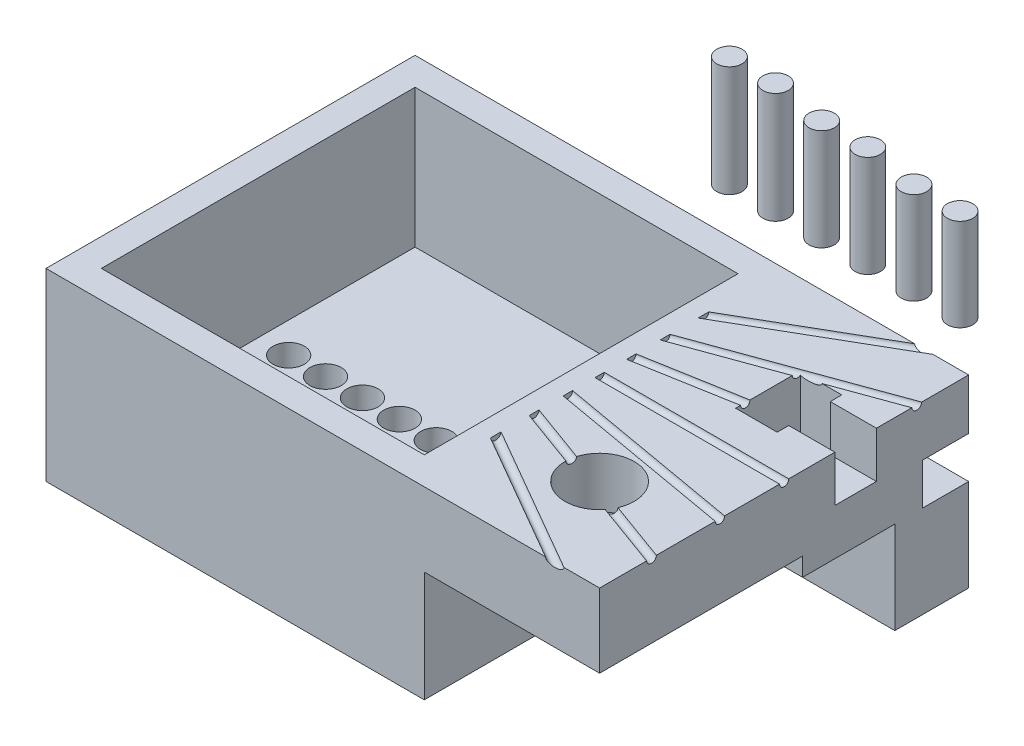
from build123d import *

# Parameters (mm, degrees)
SKETCH1_W               = 60
SKETCH1_H               = 40
BOSS_EXTRUDE1_DEPTH     = 20
SKETCH3_W               = 35
SKETCH3_H               = 34
CUT_EXTRUDE2_DEPTH      = 15
SKETCH4_R               = 3.75
CUT_EXTRUDE3_DEPTH      = 5.5
CUT_EXTRUDE4_DEPTH      = 39.861935104
CUT_EXTRUDE4_DEPTH_BACK = 39.861935104
SKETCH5_R               = 2.25
CUT_EXTRUDE5_DEPTH      = 42.231056256
CUT_EXTRUDE5_DEPTH_BACK = 5
SKETCH6_W               = 5
SKETCH6_H               = 4.5
SKETCH7_W               = 4.5
SKETCH7_H               = 7
CUT_EXTRUDE6_DEPTH      = 6.5
SKETCH8_W               = 5
SKETCH8_H               = 4.5
CUT_EXTRUDE7_DEPTH      = 5
SKETCH9_W               = 4.5
SKETCH9_H               = 7
CUT_EXTRUDE8_DEPTH      = 6.5
SKETCH13_R              = 1.7
CUT_EXTRUDE9_DEPTH      = 3
SKETCH14_R              = 1.375
BOSS_EXTRUDE2_DEPTH     = 14
BOSS_EXTRUDE2_2_DEPTH   = 14
BOSS_EXTRUDE2_3_DEPTH   = 14
BOSS_EXTRUDE2_4_DEPTH   = 14
BOSS_EXTRUDE2_5_DEPTH   = 14
BOSS_EXTRUDE2_6_DEPTH   = 14
SKETCH17_R              = 1.375
CUT_EXTRUDE10_DEPTH     = 2
SKETCH18_R              = 1.375
CUT_EXTRUDE11_DEPTH     = 3
SKETCH19_R              = 1.375
CUT_EXTRUDE12_DEPTH     = 4
CUT_SWEEP2_PROFILE_R    = 0.5
CUT_SWEEP3_START        = 8
CUT_SWEEP3_DEPTH        = 22
CUT_SWEEP3_START_2      = 8.326128564
CUT_SWEEP3_2_DEPTH      = 22.515712442
CUT_SWEEP4_PROFILE_R    = 0.5
CUT_SWEEP5_PROFILE_R    = 0.5
BOSS_EXTRUDE3_REACH     = 55.852
SKETCH43_W              = 2
SKETCH43_H              = 2
SKETCH64_W              = 19
SKETCH64_H              = 22
CUT_EXTRUDE13_DEPTH     = 12
SKETCH65_W              = 19
SKETCH65_H              = 10
CUT_EXTRUDE14_DEPTH     = 10


# Read off the part's stored shape, not the designer's step: Cut-Sweep3
with BuildPart() as part:
    # Sketch1 → Boss-Extrude1 (new body)
    with BuildSketch(Plane(origin=(0, 0, 0), x_dir=(1, 0, 0), z_dir=(0, 1, 0))):
        Rectangle(SKETCH1_W, SKETCH1_H)
    extrude(amount=BOSS_EXTRUDE1_DEPTH)

    # Sketch3 → Cut-Extrude2 (cut)
    with BuildSketch(Plane(origin=(0, 20, 0), x_dir=(1, 0, 0), z_dir=(0, 1, 0))):
        with Locations((-9.5, 0)):
            Rectangle(SKETCH3_W, SKETCH3_H)
    extrude(amount=-CUT_EXTRUDE2_DEPTH, mode=Mode.SUBTRACT)

    # Sketch4 → Cut-Extrude3 (cut)
    with BuildSketch(Plane(origin=(0, 20, 0), x_dir=(1, 0, 0), z_dir=(0, 1, 0))):
        with Locations(Location((20, -10, 0), (0, 0, 270))):
            Circle(SKETCH4_R)
    extrude(amount=-CUT_EXTRUDE3_DEPTH, mode=Mode.SUBTRACT)

    # Sketch5 → Cut-Extrude4 (cut, two sides: drawn at the far end of the back side and taken through both)
    with BuildSketch(Plane(origin=(0, 14.5, 0), x_dir=(1, 0, 0), z_dir=(0, 1, 0)).offset(-CUT_EXTRUDE4_DEPTH_BACK)):
        with Locations(Location((20, -10, 0), (0, 0, 270))):
            Circle(SKETCH5_R)
    extrude(amount=CUT_EXTRUDE4_DEPTH + CUT_EXTRUDE4_DEPTH_BACK, mode=Mode.SUBTRACT)

    # Sketch6 → Cut-Extrude5 (cut, two sides: drawn at the far end of the back side and taken through both)
    with BuildSketch(Plane(origin=(0, 20, 0), x_dir=(1, 0, 0), z_dir=(0, 1, 0)).offset(-CUT_EXTRUDE5_DEPTH_BACK)):
        with Locations((27.5, 7.75)):
            Rectangle(SKETCH6_W, SKETCH6_H)
    extrude(amount=CUT_EXTRUDE5_DEPTH + CUT_EXTRUDE5_DEPTH_BACK, mode=Mode.SUBTRACT)

    # Sketch7 → Cut-Extrude6 (cut)
    with BuildSketch(Plane(origin=(0, 20, 0), x_dir=(1, 0, 0), z_dir=(0, 1, 0))):
        with Locations((22.75, 7.75)):
            Rectangle(SKETCH7_W, SKETCH7_H)
    extrude(amount=-CUT_EXTRUDE6_DEPTH, mode=Mode.SUBTRACT)

    # Sketch8 → Cut-Extrude7 (cut)
    with BuildSketch(Plane(origin=(0, 0, -20), x_dir=(-1, 0, 0), z_dir=(0, 0, -1))):
        with Locations((-27.5, 12.25)):
            Rectangle(SKETCH8_W, SKETCH8_H)
    extrude(amount=-CUT_EXTRUDE7_DEPTH, mode=Mode.SUBTRACT)

    # Sketch9 → Cut-Extrude8 (cut)
    with BuildSketch(Plane(origin=(0, 0, -20), x_dir=(-1, 0, 0), z_dir=(0, 0, -1))):
        with Locations((-22.75, 12.25)):
            Rectangle(SKETCH9_W, SKETCH9_H)
    extrude(amount=-CUT_EXTRUDE8_DEPTH, mode=Mode.SUBTRACT)

    # Sketch13 → Cut-Extrude9 (cut)
    with BuildSketch(Plane(origin=(0, 5, 0), x_dir=(1, 0, 0), z_dir=(0, 1, 0))):
        with Locations(Location((-23.7, 0, 0), (0, 0, 270))):
            Circle(SKETCH13_R)
        with Locations(Location((-19.7, 0, 0), (0, 0, 270))):
            Circle(SKETCH13_R)
        with Locations(Location((-15.7, 0, 0), (0, 0, 270))):
            Circle(SKETCH13_R)
        with Locations(Location((-11.7, 0, 0), (0, 0, 270))):
            Circle(SKETCH13_R)
        with Locations(Location((-7.7, 0, 0), (0, 0, 270))):
            Circle(SKETCH13_R)
        with Locations(Location((-3.7, 0, 0), (0, 0, 270))):
            Circle(SKETCH13_R)
        with Locations(Location((0.3, 0, 0), (0, 0, 270))):
            Circle(SKETCH13_R)
        with Locations(Location((4.3, 0, 0), (0, 0, 270))):
            Circle(SKETCH13_R)
    extrude(amount=-CUT_EXTRUDE9_DEPTH, mode=Mode.SUBTRACT)

    # Cut-Sweep2: sweep along a path in Sketch20
    with BuildLine(Plane(origin=(0, 20, 0), x_dir=(1, 0, 0), z_dir=(0, 1, 0))) as cut_sweep2_path:
        Line((37.484631039, -17.101007166), (-9.5, 0))
        Line((-9.5, 0), (33.801270189, -25))
    # Cut-Sweep2 profile (on start of the path) → Cut-Sweep2 (sweep, cut)
    with BuildSketch(Plane(origin=(37.484631039, 20, 17.101007166), x_dir=(0.3420201433256682, 0, -0.9396926207859086), z_dir=(-0.9396926207859086, 0, -0.3420201433256682))):
        Circle(CUT_SWEEP2_PROFILE_R)
    sweep(path=cut_sweep2_path.line, transition=Transition.RIGHT, mode=Mode.SUBTRACT)

    # Cut-Sweep3 outline → Cut-Sweep3 (cut)
    with BuildSketch(Plane.YZ.offset(CUT_SWEEP3_START)):
        with BuildLine():
            ThreePointArc((20, 0.5), (19.5, 0), (20, -0.5))
            Line((20, -0.5), (20, 0.5))
        make_face()
    extrude(amount=CUT_SWEEP3_DEPTH, mode=Mode.SUBTRACT)

    # Cut-Sweep3 2 outline → Cut-Sweep3 2 (cut)
    with BuildSketch(Plane(origin=(0, 0, 0), x_dir=(0, 1, 0), z_dir=(0.9848077530122084, 0, 0.17364817766692905)).offset(CUT_SWEEP3_START_2)):
        with BuildLine():
            Line((20, 1.149657688), (20, 2.149657688))
            ThreePointArc((20, 2.149657688), (19.5, 1.649657688), (20, 1.149657688))
        make_face()
    extrude(amount=CUT_SWEEP3_2_DEPTH, mode=Mode.SUBTRACT)

    # Cut-Sweep4: sweep along a path in Sketch29
    with BuildLine(Plane(origin=(0, 20, 0), x_dir=(1, 0, 0), z_dir=(0, 1, 0))) as cut_sweep4_path:
        Line((37.484631039, 17.101007166), (-9.5, 0))
        Line((-9.5, 0), (39.740387651, 8.682408883))
    # Cut-Sweep4 profile (on start of the path) → Cut-Sweep4 (sweep, cut)
    with BuildSketch(Plane(origin=(37.484631039, 20, -17.101007166), x_dir=(-0.3420201433256707, 0, -0.9396926207859078), z_dir=(-0.9396926207859078, 0, 0.3420201433256707))):
        Circle(CUT_SWEEP4_PROFILE_R)
    sweep(path=cut_sweep4_path.line, transition=Transition.RIGHT, mode=Mode.SUBTRACT)

    # Cut-Sweep5: sweep along a path in Sketch36
    with BuildLine(Plane(origin=(0, 20, 0), x_dir=(1, 0, 0), z_dir=(0, 1, 0))) as cut_sweep5_path:
        Line((-9.5, 0), (33.801270189, 25))
    # Cut-Sweep5 profile (on start of the path) → Cut-Sweep5 (sweep, cut)
    with BuildSketch(Plane(origin=(-9.5, 20, 0), x_dir=(0.5000000000000024, 0, 0.8660254037844373), z_dir=(0.8660254037844373, 0, -0.5000000000000024))):
        Circle(CUT_SWEEP5_PROFILE_R)
    sweep(path=cut_sweep5_path.line, mode=Mode.SUBTRACT)

    # Boss-Extrude3: up to this face of the body (flat: up to its plane)
    boss_extrude3_end = Plane(part.part.faces().sort_by_distance((-0.016465533, 9.993589709, 20))[0])
    # Sketch43 → Boss-Extrude3 (add, up to the picked face)
    with BuildSketch(Plane(origin=(0, 0, -20), x_dir=(-1, 0, 0), z_dir=(0, 0, -1)), mode=Mode.PRIVATE) as boss_extrude3_sk1:
        with Locations((-9, 19)):
            Rectangle(SKETCH43_W, SKETCH43_H)
    boss_extrude3_tool1 = split(extrude(boss_extrude3_sk1.sketch, amount=-BOSS_EXTRUDE3_REACH, mode=Mode.PRIVATE), bisect_by=boss_extrude3_end, keep=Keep.BOTH, mode=Mode.PRIVATE)
    add(boss_extrude3_tool1.solids().sort_by(Axis((9, 19, -20), (0, 0, 1)))[0])

    # Sketch64 → Cut-Extrude13 (cut)
    with BuildSketch(Plane.XZ):
        with Locations((20.5, 9)):
            Rectangle(SKETCH64_W, SKETCH64_H)
    extrude(amount=-CUT_EXTRUDE13_DEPTH, mode=Mode.SUBTRACT)

    # Sketch65 → Cut-Extrude14 (cut)
    with BuildSketch(Plane.XY.offset(-2)):
        with Locations((20.5, 5)):
            Rectangle(SKETCH65_W, SKETCH65_H)
    extrude(amount=-CUT_EXTRUDE14_DEPTH, mode=Mode.SUBTRACT)


with BuildPart() as body_2:
    # Sketch14 → Boss-Extrude2 (new body)
    with BuildSketch(Plane(origin=(0, 0, 0), x_dir=(1, 0, 0), z_dir=(0, 1, 0))):
        with Locations(Location((-20.856275458, 44.923746701, 0), (0, 0, 270))):
            Circle(SKETCH14_R)
    extrude(amount=BOSS_EXTRUDE2_DEPTH)


with BuildPart() as body_3:
    # Sketch14 → Boss-Extrude2 2 (new body)
    with BuildSketch(Plane(origin=(0, 0, 0), x_dir=(1, 0, 0), z_dir=(0, 1, 0))):
        with Locations(Location((-15.856275458, 44.923746701, 0), (0, 0, 270))):
            Circle(SKETCH14_R)
    extrude(amount=BOSS_EXTRUDE2_2_DEPTH)


with BuildPart() as body_4:
    # Sketch14 → Boss-Extrude2 3 (new body)
    with BuildSketch(Plane(origin=(0, 0, 0), x_dir=(1, 0, 0), z_dir=(0, 1, 0))):
        with Locations(Location((-10.856275458, 44.923746701, 0), (0, 0, 270))):
            Circle(SKETCH14_R)
    extrude(amount=BOSS_EXTRUDE2_3_DEPTH)


with BuildPart() as body_5:
    # Sketch14 → Boss-Extrude2 4 (new body)
    with BuildSketch(Plane(origin=(0, 0, 0), x_dir=(1, 0, 0), z_dir=(0, 1, 0))):
        with Locations(Location((-5.856275458, 44.923746701, 0), (0, 0, 270))):
            Circle(SKETCH14_R)
    extrude(amount=BOSS_EXTRUDE2_4_DEPTH)


with BuildPart() as body_6:
    # Sketch14 → Boss-Extrude2 5 (new body)
    with BuildSketch(Plane(origin=(0, 0, 0), x_dir=(1, 0, 0), z_dir=(0, 1, 0))):
        with Locations(Location((-0.856275458, 44.923746701, 0), (0, 0, 270))):
            Circle(SKETCH14_R)
    extrude(amount=BOSS_EXTRUDE2_5_DEPTH)


with BuildPart() as body_7:
    # Sketch14 → Boss-Extrude2 6 (new body)
    with BuildSketch(Plane(origin=(0, 0, 0), x_dir=(1, 0, 0), z_dir=(0, 1, 0))):
        with Locations(Location((4.143724542, 44.923746701, 0), (0, 0, 270))):
            Circle(SKETCH14_R)
    extrude(amount=BOSS_EXTRUDE2_6_DEPTH)


with BuildPart() as cut_extrude10_tool:
    # Sketch17 → Cut-Extrude10 (new body)
    with BuildSketch(Plane(origin=(0, 14, 0), x_dir=(1, 0, 0), z_dir=(0, 1, 0))):
        with Locations(Location((-20.856275458, 44.923746701, 0), (0, 0, 270))):
            Circle(SKETCH17_R)
        with Locations(Location((-15.856275458, 44.923746701, 0), (0, 0, 270))):
            Circle(SKETCH17_R)
    extrude(amount=-CUT_EXTRUDE10_DEPTH)


with BuildPart() as body_2_1:
    add(body_2.part)

    # Cut-Extrude10: cut by cut_extrude10_tool
    add(cut_extrude10_tool.part, mode=Mode.SUBTRACT)


with BuildPart() as body_3_1:
    add(body_3.part)

    # Cut-Extrude10: cut by cut_extrude10_tool
    add(cut_extrude10_tool.part, mode=Mode.SUBTRACT)


with BuildPart() as cut_extrude11_tool:
    # Sketch18 → Cut-Extrude11 (new body)
    with BuildSketch(Plane(origin=(0, 14, 0), x_dir=(1, 0, 0), z_dir=(0, 1, 0))):
        with Locations(Location((-10.856275458, 44.923746701, 0), (0, 0, 270))):
            Circle(SKETCH18_R)
        with Locations(Location((-5.856275458, 44.923746701, 0), (0, 0, 270))):
            Circle(SKETCH18_R)
    extrude(amount=-CUT_EXTRUDE11_DEPTH)


with BuildPart() as body_4_1:
    add(body_4.part)

    # Cut-Extrude11: cut by cut_extrude11_tool
    add(cut_extrude11_tool.part, mode=Mode.SUBTRACT)


with BuildPart() as body_5_1:
    add(body_5.part)

    # Cut-Extrude11: cut by cut_extrude11_tool
    add(cut_extrude11_tool.part, mode=Mode.SUBTRACT)


with BuildPart() as cut_extrude12_tool:
    # Sketch19 → Cut-Extrude12 (new body)
    with BuildSketch(Plane(origin=(0, 14, 0), x_dir=(1, 0, 0), z_dir=(0, 1, 0))):
        with Locations(Location((-0.856275458, 44.923746701, 0), (0, 0, 270))):
            Circle(SKETCH19_R)
        with Locations(Location((4.143724542, 44.923746701, 0), (0, 0, 270))):
            Circle(SKETCH19_R)
    extrude(amount=-CUT_EXTRUDE12_DEPTH)


with BuildPart() as body_6_1:
    add(body_6.part)

    # Cut-Extrude12: cut by cut_extrude12_tool
    add(cut_extrude12_tool.part, mode=Mode.SUBTRACT)


with BuildPart() as body_7_1:
    add(body_7.part)

    # Cut-Extrude12: cut by cut_extrude12_tool
    add(cut_extrude12_tool.part, mode=Mode.SUBTRACT)


solid = Compound([part.part, body_2_1.part, body_3_1.part, body_4_1.part, body_5_1.part, body_6_1.part, body_7_1.part])
